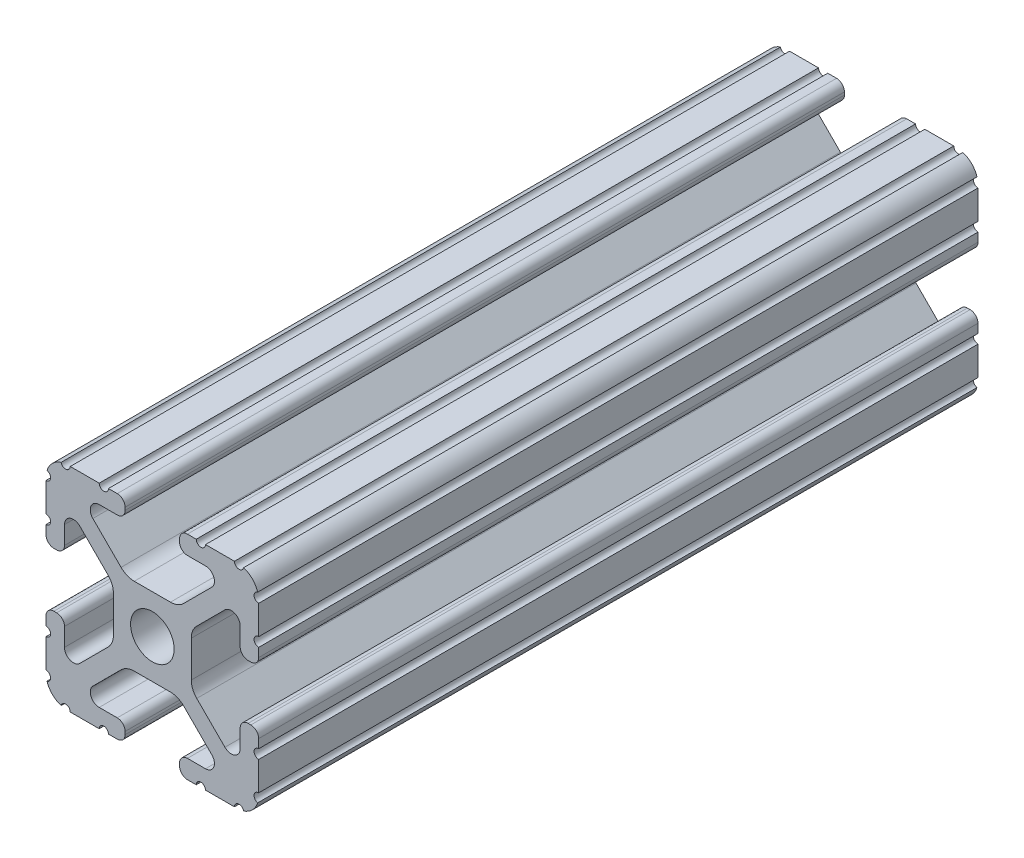
from build123d import *

# Parameters (mm, degrees)
BOSS_EXTRUDE1_DEPTH     = 42.95
CUT_EXTRUDE1_DEPTH      = 47.554081454
CUT_EXTRUDE1_DEPTH_BACK = 47.554081454
SKETCH5_R               = 0.55245
CUT_EXTRUDE2_DEPTH      = 47.554081454
CUT_EXTRUDE2_DEPTH_BACK = 47.554081454
SKETCH6_R               = 2.555
CUT_EXTRUDE3_DEPTH      = 47.554081546
CUT_EXTRUDE3_DEPTH_BACK = 47.554081546
SKETCH7_R               = 2.54


with BuildPart() as part:
    # Sketch4 → Boss-Extrude1 (new, symmetric)
    with BuildSketch(Plane.XY):
        with BuildLine():
            Line((4.190365, -12.7), (10.11729625, -12.7))
            ThreePointArc((10.11729625, -12.7), (11.943543585, -11.943543585), (12.7, -10.11729625))
            Line((12.7, -10.11729625), (12.7, -4.190365))
            ThreePointArc((12.7, -4.190365), (12.42492494, -3.52627506), (11.760835, -3.2512))
            Line((11.760835, -3.2512), (11.429365, -3.2512))
            ThreePointArc((11.429365, -3.2512), (10.76527506, -3.52627506), (10.4902, -4.190365))
            Line((10.4902, -4.190365), (10.4902, -6.348478019))
            ThreePointArc((10.4902, -6.348478019), (9.830707141, -7.335478831), (8.666460301, -7.103895736))
            Line((8.666460301, -7.103895736), (5.299899128, -3.737334563))
            ThreePointArc((5.299899128, -3.737334563), (4.817571085, -3.015479634), (4.6482, -2.16399369))
            Line((4.6482, -2.16399369), (4.6482, 0))
            Line((4.6482, 0), (2.6035, 0))
            ThreePointArc((2.6035, 0), (1.840952505, -1.840952505), (0, -2.6035))
            Line((0, -2.6035), (0, -4.6482))
            Line((0, -4.6482), (2.16399369, -4.6482))
            ThreePointArc((2.16399369, -4.6482), (3.015479634, -4.817571085), (3.737334563, -5.299899128))
            Line((3.737334563, -5.299899128), (7.103895736, -8.666460301))
            ThreePointArc((7.103895736, -8.666460301), (7.335478831, -9.830707141), (6.348478019, -10.4902))
            Line((6.348478019, -10.4902), (4.190365, -10.4902))
            ThreePointArc((4.190365, -10.4902), (3.52627506, -10.76527506), (3.2512, -11.429365))
            Line((3.2512, -11.429365), (3.2512, -11.760835))
            ThreePointArc((3.2512, -11.760835), (3.52627506, -12.42492494), (4.190365, -12.7))
        make_face()
    extrude(amount=BOSS_EXTRUDE1_DEPTH, both=True)

    # Sketch5 → Cut-Extrude1 (cut, two sides: drawn at the far end of the back side and taken through both)
    with BuildSketch(Plane.XY.offset(-CUT_EXTRUDE1_DEPTH_BACK)):
        with Locations((10.356153152, -12.7)):
            Circle(SKETCH5_R)
        with Locations((5.796028019, -12.7)):
            Circle(SKETCH5_R)
        with Locations((12.7, -10.356153152)):
            Circle(SKETCH5_R)
        with Locations((12.7, -5.796028019)):
            Circle(SKETCH5_R)
    extrude(amount=CUT_EXTRUDE1_DEPTH + CUT_EXTRUDE1_DEPTH_BACK, mode=Mode.SUBTRACT)

    # Mirror1: part across plane


with BuildPart() as part_1:
    add(part.part)
    add(part.part.mirror(Plane(origin=(0, 0, 0), x_dir=(0, 0, 1), z_dir=(1, 0, 0))))

    # Mirror2: part across plane


with BuildPart() as part_2:
    add(part_1.part)
    add(part_1.part.mirror(Plane.ZX))

    # Sketch6 → Cut-Extrude2 (cut, two sides: drawn at the far end of the back side and taken through both)
    with BuildSketch(Plane(origin=(0, 0, 0), x_dir=(1, 0, 0), z_dir=(0, 1, 0)).offset(-CUT_EXTRUDE2_DEPTH_BACK)):
        with Locations((0, -30.25)):
            Circle(SKETCH6_R)
        with Locations((0, 30.25)):
            Circle(SKETCH6_R)
    extrude(amount=CUT_EXTRUDE2_DEPTH + CUT_EXTRUDE2_DEPTH_BACK, mode=Mode.SUBTRACT)

    # Sketch7 → Cut-Extrude3 (cut, two sides: drawn at the far end of the back side and taken through both)
    with BuildSketch(Plane(origin=(0, 0, 0), x_dir=(0, 0, -1), z_dir=(1, 0, 0)).offset(-CUT_EXTRUDE3_DEPTH_BACK)):
        with Locations((17.55, 0)):
            Circle(SKETCH7_R)
        with Locations((-17.55, 0)):
            Circle(SKETCH7_R)
    extrude(amount=CUT_EXTRUDE3_DEPTH + CUT_EXTRUDE3_DEPTH_BACK, mode=Mode.SUBTRACT)


solid = part_2.part
